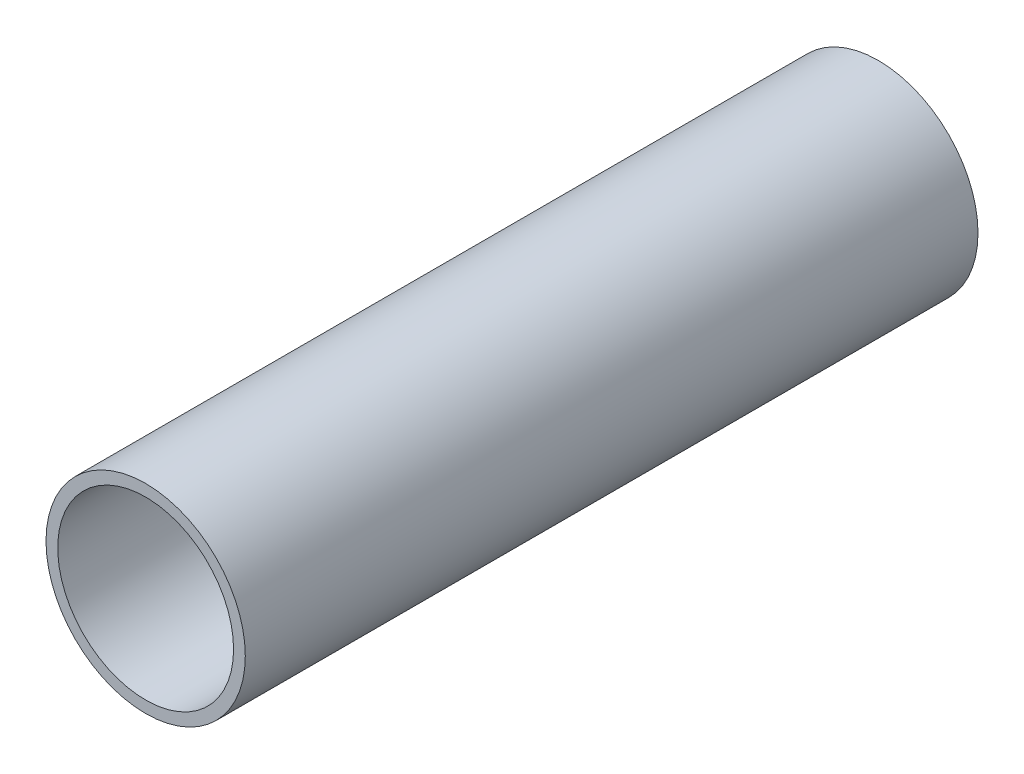
from build123d import *

# Parameters (mm, degrees)
SKETCH1_R           = 34
SKETCH1_R_2         = 30
BOSS_EXTRUDE1_DEPTH = 250


with BuildPart() as part:
    # Sketch1 → Boss-Extrude1 (new body)
    with BuildSketch(Plane.XY):
        Circle(SKETCH1_R)
        Circle(SKETCH1_R_2, mode=Mode.SUBTRACT)
    extrude(amount=BOSS_EXTRUDE1_DEPTH)


solid = part.part
